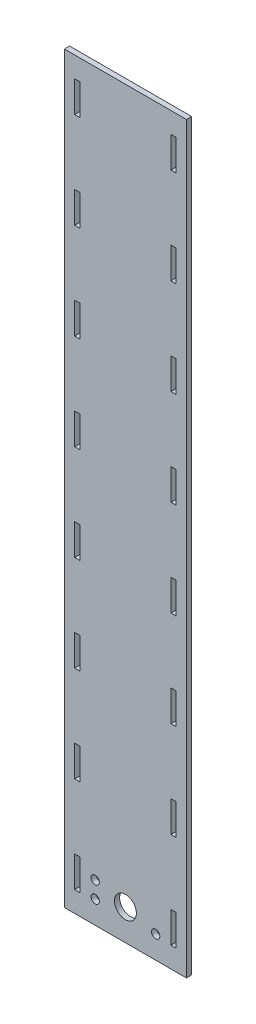
from build123d import *

# Parameters (mm, degrees)
SKETCH1_W               = 75.050000014
SKETCH1_H               = 457.2
BOSS_EXTRUDE1_DEPTH     = 3.175
SKETCH8_W               = 3.175
SKETCH8_H               = 19.05
CUT_EXTRUDE2_DEPTH      = 232.681173708
CRVPATTERN1_START       = -31.175
CRVPATTERN1_OUTLINE_W   = 19.05
CRVPATTERN1_OUTLINE_H   = 3.175
CRVPATTERN1_DEPTH       = 3.175
CRVPATTERN1_START_2     = 28
CRVPATTERN1_2_OUTLINE_W = 19.05
CRVPATTERN1_2_OUTLINE_H = 3.175
CRVPATTERN1_2_DEPTH     = 3.175
SKETCH10_R              = 6.731
CUT_EXTRUDE3_DEPTH      = 232.681173708
F_10_CLEARANCE_HOLE1_D  = 5.1054


# Read off the part's stored shape, not the designer's step: CrvPattern1
with BuildPart() as part:
    # Sketch1 → Boss-Extrude1 (new body)
    with BuildSketch(Plane.XY):
        Rectangle(SKETCH1_W, SKETCH1_H)
    extrude(amount=BOSS_EXTRUDE1_DEPTH)

    # Sketch8 → Cut-Extrude2 (cut, through all)
    with BuildSketch(Plane(origin=(0, 0, 0), x_dir=(-1, 0, 0), z_dir=(0, 0, -1))):
        with Locations((-29.5875, 206.375)):
            Rectangle(SKETCH8_W, SKETCH8_H)
        with Locations((29.5875, 206.375)):
            Rectangle(SKETCH8_W, SKETCH8_H)
    extrude(amount=-CUT_EXTRUDE2_DEPTH, mode=Mode.SUBTRACT)

    # CrvPattern1 outline → CrvPattern1 (cut)
    with BuildSketch(Plane.YZ.offset(CRVPATTERN1_START)):
        with Locations((147.410714286, 1.5875)):
            Rectangle(CRVPATTERN1_OUTLINE_W, CRVPATTERN1_OUTLINE_H)
        with Locations((88.446428571, 1.5875)):
            Rectangle(CRVPATTERN1_OUTLINE_W, CRVPATTERN1_OUTLINE_H)
        with Locations((29.482142857, 1.5875)):
            Rectangle(CRVPATTERN1_OUTLINE_W, CRVPATTERN1_OUTLINE_H)
        with Locations((-29.482142857, 1.5875)):
            Rectangle(CRVPATTERN1_OUTLINE_W, CRVPATTERN1_OUTLINE_H)
        with Locations((-88.446428571, 1.5875)):
            Rectangle(CRVPATTERN1_OUTLINE_W, CRVPATTERN1_OUTLINE_H)
        with Locations((-147.410714286, 1.5875)):
            Rectangle(CRVPATTERN1_OUTLINE_W, CRVPATTERN1_OUTLINE_H)
        with Locations((-206.375, 1.5875)):
            Rectangle(CRVPATTERN1_OUTLINE_W, CRVPATTERN1_OUTLINE_H)
    extrude(amount=CRVPATTERN1_DEPTH, mode=Mode.SUBTRACT)

    # CrvPattern1 2 outline → CrvPattern1 2 (cut)
    with BuildSketch(Plane.YZ.offset(CRVPATTERN1_START_2)):
        with Locations((147.410714286, 1.5875)):
            Rectangle(CRVPATTERN1_2_OUTLINE_W, CRVPATTERN1_2_OUTLINE_H)
        with Locations((88.446428571, 1.5875)):
            Rectangle(CRVPATTERN1_2_OUTLINE_W, CRVPATTERN1_2_OUTLINE_H)
        with Locations((29.482142857, 1.5875)):
            Rectangle(CRVPATTERN1_2_OUTLINE_W, CRVPATTERN1_2_OUTLINE_H)
        with Locations((-29.482142857, 1.5875)):
            Rectangle(CRVPATTERN1_2_OUTLINE_W, CRVPATTERN1_2_OUTLINE_H)
        with Locations((-88.446428571, 1.5875)):
            Rectangle(CRVPATTERN1_2_OUTLINE_W, CRVPATTERN1_2_OUTLINE_H)
        with Locations((-147.410714286, 1.5875)):
            Rectangle(CRVPATTERN1_2_OUTLINE_W, CRVPATTERN1_2_OUTLINE_H)
        with Locations((-206.375, 1.5875)):
            Rectangle(CRVPATTERN1_2_OUTLINE_W, CRVPATTERN1_2_OUTLINE_H)
    extrude(amount=CRVPATTERN1_2_DEPTH, mode=Mode.SUBTRACT)

    # Sketch10 → Cut-Extrude3 (cut, through all)
    with BuildSketch(Plane(origin=(0, 0, 0), x_dir=(-1, 0, 0), z_dir=(0, 0, -1))):
        with Locations((0, -209.55)):
            Circle(SKETCH10_R)
    extrude(amount=-CUT_EXTRUDE3_DEPTH, mode=Mode.SUBTRACT)

    # #10 Clearance Hole1 (through all)
    with Locations(Plane(origin=(0, 0, 0), x_dir=(-1, 0, 0), z_dir=(0, 0, -1))):
        with Locations((18.602, -214.63), (18.602, -204.47), (-18.602, -214.63), (-18.602, -280.67)):
            Hole(F_10_CLEARANCE_HOLE1_D / 2)


solid = part.part
